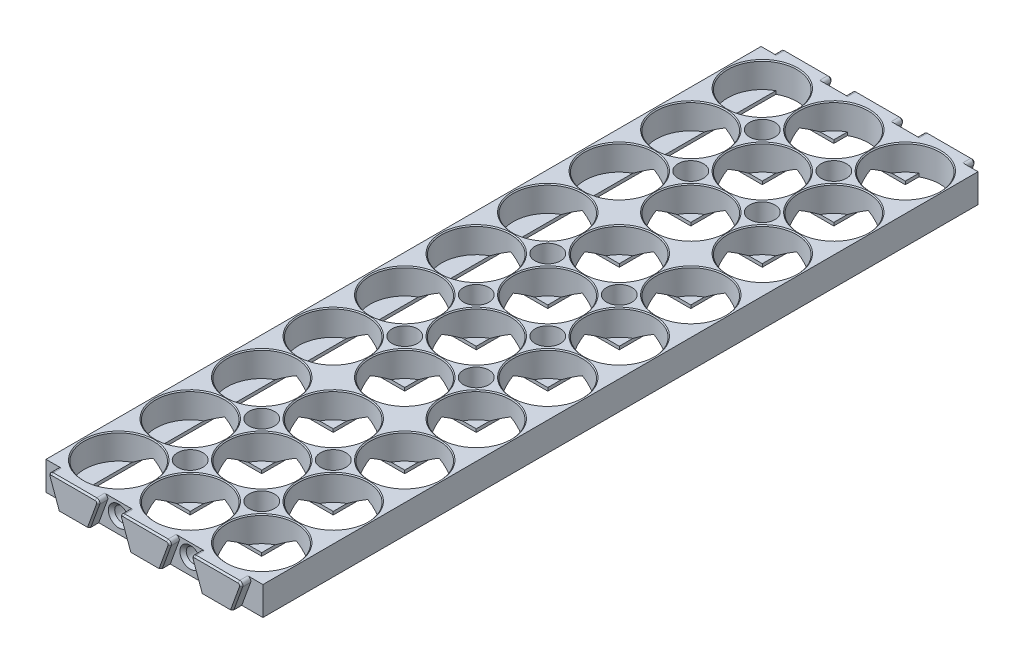
from build123d import *

# Parameters (mm, degrees)
SKETCH1_W                  = 22.5
SKETCH1_H                  = 22.5
SKETCH1_R                  = 10.875
BOSS_EXTRUDE1_DEPTH        = 8
SKETCH2_W                  = 6
SKETCH2_H                  = 6
BOSS_EXTRUDE2_DEPTH        = 1
CHAMFER2_SIZE              = 0.3
LPATTERN1_COUNT            = 10
LPATTERN1_PITCH            = 22.5
LPATTERN1_COUNT_DIR2       = 3
LPATTERN1_PITCH_DIR2       = 22.5
CHAMFER2_OF_LPATTERN1_SIZE = 0.3
SKETCH5_W                  = 6
SKETCH5_H                  = 1
BOSS_EXTRUDE3_DEPTH        = 213
BOSS_EXTRUDE4_START        = 1
BOSS_EXTRUDE4_DEPTH        = 1
CUT_EXTRUDE1_REACH         = 223.172
CUT_EXTRUDE7_REACH         = 223.172
BOSS_EXTRUDE5_DEPTH        = 3
BOSS_EXTRUDE6_DEPTH        = 3
FILLET1_R                  = 1
CHAMFER3_SIZE              = 0.5
SKETCH10_R                 = 2.25
CUT_EXTRUDE2_DEPTH         = 5
CUT_EXTRUDE3_START         = -5
SKETCH11_R                 = 2.25
CUT_EXTRUDE3_DEPTH         = 5
CHAMFER5_SIZE              = 1
SKETCH17_R                 = 4
CUT_EXTRUDE8_DEPTH         = 225.110742714
SKETCH18_R                 = 2.1
CUT_EXTRUDE9_DEPTH         = 4
SKETCH19_R                 = 1.7
CUT_EXTRUDE10_DEPTH        = 7
CHAMFER6_SIZE              = 1
SKETCH22_W                 = 0.375
SKETCH22_H                 = 225
BOSS_EXTRUDE7_DEPTH        = 9
CUT_EXTRUDE11_DEPTH        = 2
CHAMFER7_SIZE              = 0.5


with BuildPart() as part:
    # Sketch1 → Boss-Extrude1 (new body)
    with BuildSketch(Plane(origin=(0, 0, 0), x_dir=(1, 0, 0), z_dir=(0, 1, 0))):
        Rectangle(SKETCH1_W, SKETCH1_H)
        with Locations(Location((0, 0, 0), (0, 0, 270))):
            Circle(SKETCH1_R, mode=Mode.SUBTRACT)
    boss_extrude1 = extrude(amount=BOSS_EXTRUDE1_DEPTH)

    # Sketch2 → Boss-Extrude2 (add)
    with BuildSketch(Plane.XZ):
        with Locations((8.25, 8.25)):
            Rectangle(SKETCH2_W, SKETCH2_H)
        with Locations((8.25, -8.25)):
            Rectangle(SKETCH2_W, SKETCH2_H)
        with Locations((-8.25, -8.25)):
            Rectangle(SKETCH2_W, SKETCH2_H)
        with Locations((-8.25, 8.25)):
            Rectangle(SKETCH2_W, SKETCH2_H)
    boss_extrude2 = extrude(amount=BOSS_EXTRUDE2_DEPTH)

    # Chamfer2
    chamfer2_edges = [part.edges().sort_by_distance(p)[0] for p in [
        (0, 8, -10.875),
    ]]
    chamfer(chamfer2_edges, length=CHAMFER2_SIZE)

    # LPattern1: Boss-Extrude1, Boss-Extrude2 10 × 3
    with Locations(*[(j * LPATTERN1_PITCH_DIR2, 0, i * LPATTERN1_PITCH) for i in range(LPATTERN1_COUNT) for j in range(LPATTERN1_COUNT_DIR2) if (i, j) != (0, 0)]):
        add(boss_extrude1)
        add(boss_extrude2)

    # Chamfer2 of LPattern1
    chamfer2_of_lpattern1_edges = [part.edges().sort_by_distance(p)[0] for p in [
        (22.5, 8, -10.875),
        (45, 8, -10.875),
        (0, 8, 11.625),
        (22.5, 8, 11.625),
        (45, 8, 11.625),
        (0, 8, 34.125),
        (22.5, 8, 34.125),
        (45, 8, 34.125),
        (0, 8, 56.625),
        (22.5, 8, 56.625),
        (45, 8, 56.625),
        (0, 8, 79.125),
        (22.5, 8, 79.125),
        (45, 8, 79.125),
        (0, 8, 101.625),
        (22.5, 8, 101.625),
        (45, 8, 101.625),
        (0, 8, 124.125),
        (22.5, 8, 124.125),
        (45, 8, 124.125),
        (0, 8, 146.625),
        (22.5, 8, 146.625),
        (45, 8, 146.625),
        (0, 8, 169.125),
        (22.5, 8, 169.125),
        (45, 8, 169.125),
        (0, 8, 191.625),
        (22.5, 8, 191.625),
        (45, 8, 191.625),
    ]]
    chamfer(chamfer2_of_lpattern1_edges, length=CHAMFER2_OF_LPATTERN1_SIZE)

    # Sketch5 → Boss-Extrude3 (add)
    with BuildSketch(Plane.XY.offset(-5.25)):
        with Locations((-8.25, -0.5)):
            Rectangle(SKETCH5_W, SKETCH5_H)
        with Locations((53.25, -0.5)):
            Rectangle(SKETCH5_W, SKETCH5_H)
    extrude(amount=BOSS_EXTRUDE3_DEPTH)

    # Sketch6 → Boss-Extrude4 (add)
    with BuildSketch(Plane.XZ.offset(BOSS_EXTRUDE4_START)):
        with BuildLine():
            Line((39.75, -11.25), (50.25, -11.25))
            Line((50.25, -11.25), (50.25, -9.523818824))
            ThreePointArc((50.25, -9.523818824), (45, -10.875), (39.75, -9.523818824))
            Line((39.75, -9.523818824), (39.75, -11.25))
        make_face()
        with BuildLine():
            Line((17.25, -9.523818824), (17.25, -11.25))
            Line((17.25, -11.25), (27.75, -11.25))
            Line((27.75, -11.25), (27.75, -9.523818824))
            ThreePointArc((27.75, -9.523818824), (22.5, -10.875), (17.25, -9.523818824))
        make_face()
        with BuildLine():
            Line((-5.25, -9.523818824), (-5.25, -11.25))
            Line((-5.25, -11.25), (5.25, -11.25))
            Line((5.25, -11.25), (5.25, -9.523818824))
            ThreePointArc((5.25, -9.523818824), (0, -10.875), (-5.25, -9.523818824))
        make_face()
        with BuildLine():
            Line((50.25, 212.023818824), (50.25, 213.75))
            Line((50.25, 213.75), (39.75, 213.75))
            Line((39.75, 213.75), (39.75, 212.023818824))
            ThreePointArc((39.75, 212.023818824), (45, 213.375), (50.25, 212.023818824))
        make_face()
        with BuildLine():
            Line((27.75, 212.023818824), (27.75, 213.75))
            Line((27.75, 213.75), (17.25, 213.75))
            Line((17.25, 213.75), (17.25, 212.023818824))
            ThreePointArc((17.25, 212.023818824), (22.5, 213.375), (27.75, 212.023818824))
        make_face()
        with BuildLine():
            Line((5.25, 213.75), (-5.25, 213.75))
            Line((-5.25, 213.75), (-5.25, 212.023818824))
            ThreePointArc((-5.25, 212.023818824), (0, 213.375), (5.25, 212.023818824))
            Line((5.25, 212.023818824), (5.25, 213.75))
        make_face()
    extrude(amount=-BOSS_EXTRUDE4_DEPTH)

    # Cut-Extrude1: up to this face of the body (flat: up to its plane)
    cut_extrude1_end = Plane(part.part.faces().sort_by_distance((11.25, -0.5, 207.75))[0])
    # Sketch7 → Cut-Extrude1 (cut, up to the picked face)
    with BuildSketch(Plane.XY, mode=Mode.PRIVATE) as cut_extrude1_sk1:
        Polygon((-5.25, 0), (5.25, 0), (0, 3.031088913), align=None)
    cut_extrude1_tool1 = split(extrude(cut_extrude1_sk1.sketch, amount=CUT_EXTRUDE1_REACH, mode=Mode.PRIVATE), bisect_by=cut_extrude1_end, keep=Keep.BOTH, mode=Mode.PRIVATE)
    # Sketch7 → Cut-Extrude1 (cut, up to the picked face)
    with BuildSketch(Plane.XY, mode=Mode.PRIVATE) as cut_extrude1_sk2:
        Polygon((17.25, 0), (22.5, 3.031088913), (27.75, 0), align=None)
    cut_extrude1_tool2 = split(extrude(cut_extrude1_sk2.sketch, amount=CUT_EXTRUDE1_REACH, mode=Mode.PRIVATE), bisect_by=cut_extrude1_end, keep=Keep.BOTH, mode=Mode.PRIVATE)
    # Sketch7 → Cut-Extrude1 (cut, up to the picked face)
    with BuildSketch(Plane.XY, mode=Mode.PRIVATE) as cut_extrude1_sk3:
        Polygon((39.75, 0), (45, 3.031088913), (50.25, 0), align=None)
    cut_extrude1_tool3 = split(extrude(cut_extrude1_sk3.sketch, amount=CUT_EXTRUDE1_REACH, mode=Mode.PRIVATE), bisect_by=cut_extrude1_end, keep=Keep.BOTH, mode=Mode.PRIVATE)
    # Sketch7 → Cut-Extrude1 (cut, up to the picked face)
    with BuildSketch(Plane.XY, mode=Mode.PRIVATE) as cut_extrude1_sk4:
        Polygon((62.25, 0), (67.5, 3.031088913), (72.75, 0), align=None)
    cut_extrude1_tool4 = split(extrude(cut_extrude1_sk4.sketch, amount=CUT_EXTRUDE1_REACH, mode=Mode.PRIVATE), bisect_by=cut_extrude1_end, keep=Keep.BOTH, mode=Mode.PRIVATE)
    add(cut_extrude1_tool1.solids().sort_by(Axis((0, 1.010363, 0), (0, 0, 1)))[0], mode=Mode.SUBTRACT)
    add(cut_extrude1_tool2.solids().sort_by(Axis((22.5, 1.010363, 0), (0, 0, 1)))[0], mode=Mode.SUBTRACT)
    add(cut_extrude1_tool3.solids().sort_by(Axis((45, 1.010363, 0), (0, 0, 1)))[0], mode=Mode.SUBTRACT)
    add(cut_extrude1_tool4.solids().sort_by(Axis((67.5, 1.010363, 0), (0, 0, 1)))[0], mode=Mode.SUBTRACT)

    # Cut-Extrude7: up to this face of the body (flat: up to its plane)
    cut_extrude7_end = Plane(part.part.faces().sort_by_distance((39.75, -0.5, -7.386909412))[0])
    # Sketch16 → Cut-Extrude7 (cut, up to the picked face)
    with BuildSketch(Plane(origin=(0, 0, 0), x_dir=(0, 0, -1), z_dir=(1, 0, 0)), mode=Mode.PRIVATE) as cut_extrude7_sk1:
        Polygon((-5.25, 0), (0, 3.031088913), (5.25, 0), align=None)
    cut_extrude7_tool1 = split(extrude(cut_extrude7_sk1.sketch, amount=CUT_EXTRUDE7_REACH, mode=Mode.PRIVATE), bisect_by=cut_extrude7_end, keep=Keep.BOTH, mode=Mode.PRIVATE)
    # Sketch16 → Cut-Extrude7 (cut, up to the picked face)
    with BuildSketch(Plane(origin=(0, 0, 0), x_dir=(0, 0, -1), z_dir=(1, 0, 0)), mode=Mode.PRIVATE) as cut_extrude7_sk2:
        Polygon((-22.5, 3.031088913), (-17.25, 0), (-27.75, 0), align=None)
    cut_extrude7_tool2 = split(extrude(cut_extrude7_sk2.sketch, amount=CUT_EXTRUDE7_REACH, mode=Mode.PRIVATE), bisect_by=cut_extrude7_end, keep=Keep.BOTH, mode=Mode.PRIVATE)
    # Sketch16 → Cut-Extrude7 (cut, up to the picked face)
    with BuildSketch(Plane(origin=(0, 0, 0), x_dir=(0, 0, -1), z_dir=(1, 0, 0)), mode=Mode.PRIVATE) as cut_extrude7_sk3:
        Polygon((-45, 3.031088913), (-39.75, 0), (-50.25, 0), align=None)
    cut_extrude7_tool3 = split(extrude(cut_extrude7_sk3.sketch, amount=CUT_EXTRUDE7_REACH, mode=Mode.PRIVATE), bisect_by=cut_extrude7_end, keep=Keep.BOTH, mode=Mode.PRIVATE)
    # Sketch16 → Cut-Extrude7 (cut, up to the picked face)
    with BuildSketch(Plane(origin=(0, 0, 0), x_dir=(0, 0, -1), z_dir=(1, 0, 0)), mode=Mode.PRIVATE) as cut_extrude7_sk4:
        Polygon((-67.5, 3.031088913), (-62.25, 0), (-72.75, 0), align=None)
    cut_extrude7_tool4 = split(extrude(cut_extrude7_sk4.sketch, amount=CUT_EXTRUDE7_REACH, mode=Mode.PRIVATE), bisect_by=cut_extrude7_end, keep=Keep.BOTH, mode=Mode.PRIVATE)
    # Sketch16 → Cut-Extrude7 (cut, up to the picked face)
    with BuildSketch(Plane(origin=(0, 0, 0), x_dir=(0, 0, -1), z_dir=(1, 0, 0)), mode=Mode.PRIVATE) as cut_extrude7_sk5:
        Polygon((-90, 3.031088913), (-84.75, 0), (-95.25, 0), align=None)
    cut_extrude7_tool5 = split(extrude(cut_extrude7_sk5.sketch, amount=CUT_EXTRUDE7_REACH, mode=Mode.PRIVATE), bisect_by=cut_extrude7_end, keep=Keep.BOTH, mode=Mode.PRIVATE)
    # Sketch16 → Cut-Extrude7 (cut, up to the picked face)
    with BuildSketch(Plane(origin=(0, 0, 0), x_dir=(0, 0, -1), z_dir=(1, 0, 0)), mode=Mode.PRIVATE) as cut_extrude7_sk6:
        Polygon((-112.5, 3.031088913), (-107.25, 0), (-117.75, 0), align=None)
    cut_extrude7_tool6 = split(extrude(cut_extrude7_sk6.sketch, amount=CUT_EXTRUDE7_REACH, mode=Mode.PRIVATE), bisect_by=cut_extrude7_end, keep=Keep.BOTH, mode=Mode.PRIVATE)
    # Sketch16 → Cut-Extrude7 (cut, up to the picked face)
    with BuildSketch(Plane(origin=(0, 0, 0), x_dir=(0, 0, -1), z_dir=(1, 0, 0)), mode=Mode.PRIVATE) as cut_extrude7_sk7:
        Polygon((-135, 3.031088913), (-129.75, 0), (-140.25, 0), align=None)
    cut_extrude7_tool7 = split(extrude(cut_extrude7_sk7.sketch, amount=CUT_EXTRUDE7_REACH, mode=Mode.PRIVATE), bisect_by=cut_extrude7_end, keep=Keep.BOTH, mode=Mode.PRIVATE)
    # Sketch16 → Cut-Extrude7 (cut, up to the picked face)
    with BuildSketch(Plane(origin=(0, 0, 0), x_dir=(0, 0, -1), z_dir=(1, 0, 0)), mode=Mode.PRIVATE) as cut_extrude7_sk8:
        Polygon((-157.5, 3.031088913), (-152.25, 0), (-162.75, 0), align=None)
    cut_extrude7_tool8 = split(extrude(cut_extrude7_sk8.sketch, amount=CUT_EXTRUDE7_REACH, mode=Mode.PRIVATE), bisect_by=cut_extrude7_end, keep=Keep.BOTH, mode=Mode.PRIVATE)
    # Sketch16 → Cut-Extrude7 (cut, up to the picked face)
    with BuildSketch(Plane(origin=(0, 0, 0), x_dir=(0, 0, -1), z_dir=(1, 0, 0)), mode=Mode.PRIVATE) as cut_extrude7_sk9:
        Polygon((-180, 3.031088913), (-174.75, 0), (-185.25, 0), align=None)
    cut_extrude7_tool9 = split(extrude(cut_extrude7_sk9.sketch, amount=CUT_EXTRUDE7_REACH, mode=Mode.PRIVATE), bisect_by=cut_extrude7_end, keep=Keep.BOTH, mode=Mode.PRIVATE)
    # Sketch16 → Cut-Extrude7 (cut, up to the picked face)
    with BuildSketch(Plane(origin=(0, 0, 0), x_dir=(0, 0, -1), z_dir=(1, 0, 0)), mode=Mode.PRIVATE) as cut_extrude7_sk10:
        Polygon((-202.5, 3.031088913), (-197.25, 0), (-207.75, 0), align=None)
    cut_extrude7_tool10 = split(extrude(cut_extrude7_sk10.sketch, amount=CUT_EXTRUDE7_REACH, mode=Mode.PRIVATE), bisect_by=cut_extrude7_end, keep=Keep.BOTH, mode=Mode.PRIVATE)
    add(cut_extrude7_tool1.solids().sort_by(Axis((0, 1.010363, 0), (1, 0, 0)))[0], mode=Mode.SUBTRACT)
    add(cut_extrude7_tool2.solids().sort_by(Axis((0, 1.010363, 22.5), (1, 0, 0)))[0], mode=Mode.SUBTRACT)
    add(cut_extrude7_tool3.solids().sort_by(Axis((0, 1.010363, 45), (1, 0, 0)))[0], mode=Mode.SUBTRACT)
    add(cut_extrude7_tool4.solids().sort_by(Axis((0, 1.010363, 67.5), (1, 0, 0)))[0], mode=Mode.SUBTRACT)
    add(cut_extrude7_tool5.solids().sort_by(Axis((0, 1.010363, 90), (1, 0, 0)))[0], mode=Mode.SUBTRACT)
    add(cut_extrude7_tool6.solids().sort_by(Axis((0, 1.010363, 112.5), (1, 0, 0)))[0], mode=Mode.SUBTRACT)
    add(cut_extrude7_tool7.solids().sort_by(Axis((0, 1.010363, 135), (1, 0, 0)))[0], mode=Mode.SUBTRACT)
    add(cut_extrude7_tool8.solids().sort_by(Axis((0, 1.010363, 157.5), (1, 0, 0)))[0], mode=Mode.SUBTRACT)
    add(cut_extrude7_tool9.solids().sort_by(Axis((0, 1.010363, 180), (1, 0, 0)))[0], mode=Mode.SUBTRACT)
    add(cut_extrude7_tool10.solids().sort_by(Axis((0, 1.010363, 202.5), (1, 0, 0)))[0], mode=Mode.SUBTRACT)

    # Sketch8 → Boss-Extrude5 (add)
    with BuildSketch(Plane(origin=(0, 0, -11.25), x_dir=(-1, 0, 0), z_dir=(0, 0, -1))):
        Polygon((-27.474267892, -1), (-30.75, 8), (-14.25, 8), (-17.525732108, -1), align=None)
        Polygon((4.974267892, -1), (-4.974267892, -1), (-8.25, 8), (8.25, 8), align=None)
        Polygon((-49.974267892, -1), (-53.25, 8), (-36.75, 8), (-40.025732108, -1), align=None)
    extrude(amount=BOSS_EXTRUDE5_DEPTH)

    # Sketch9 → Boss-Extrude6 (add)
    with BuildSketch(Plane.XY.offset(213.75)):
        Polygon((-4.974267892, -1), (4.974267892, -1), (8.25, 8), (-8.25, 8), align=None)
        Polygon((49.974267892, -1), (53.25, 8), (36.75, 8), (40.025732108, -1), align=None)
        Polygon((14.25, 8), (17.525732108, -1), (27.474267892, -1), (30.75, 8), align=None)
    extrude(amount=BOSS_EXTRUDE6_DEPTH)

    # Fillet1
    fillet1_edges = [part.edges().sort_by_distance(p)[0] for p in [
        (-8.25, 8, -12.75),
        (8.25, 8, -12.75),
        (14.25, 8, -12.75),
        (30.75, 8, -12.75),
        (36.75, 8, -12.75),
        (53.25, 8, -12.75),
        (-8.25, 8, 215.25),
        (8.25, 8, 215.25),
        (53.25, 8, 215.25),
        (36.75, 8, 215.25),
        (30.75, 8, 215.25),
        (14.25, 8, 215.25),
    ]]
    fillet(fillet1_edges, radius=FILLET1_R)

    # Chamfer3
    chamfer3_edges = [part.edges().sort_by_distance(p)[0] for p in [
        (-6.367906253, 2.828989928, -14.25),
        (16.132093747, 2.828989928, -14.25),
        (38.632093747, 2.828989928, -14.25),
        (6.367906253, 2.828989928, 216.75),
        (51.367906253, 2.828989928, 216.75),
        (28.867906253, 2.828989928, 216.75),
        (51.367906253, 2.828989928, -14.25),
        (45, 8, -14.25),
        (22.5, 8, -14.25),
        (0, 8, -14.25),
        (0, 8, 216.75),
        (22.5, 8, 216.75),
        (45, 8, 216.75),
        (37.358995962, 7.573576436, -14.25),
        (52.641004038, 7.573576436, -14.25),
        (28.867906253, 2.828989928, -14.25),
        (14.858995962, 7.573576436, -14.25),
        (30.141004038, 7.573576436, -14.25),
        (6.367906253, 2.828989928, -14.25),
        (-7.641004038, 7.573576436, -14.25),
        (7.641004038, 7.573576436, -14.25),
        (-6.367906253, 2.828989928, 216.75),
        (7.641004038, 7.573576436, 216.75),
        (-7.641004038, 7.573576436, 216.75),
        (16.132093747, 2.828989928, 216.75),
        (30.141004038, 7.573576436, 216.75),
        (14.858995962, 7.573576436, 216.75),
        (38.632093747, 2.828989928, 216.75),
        (52.641004038, 7.573576436, 216.75),
        (37.358995962, 7.573576436, 216.75),
    ]]
    chamfer(chamfer3_edges, length=CHAMFER3_SIZE)

    # Sketch10 → Cut-Extrude2 (cut)
    with BuildSketch(Plane(origin=(0, 0, -11.25), x_dir=(-1, 0, 0), z_dir=(0, 0, -1))):
        with Locations((-11.25, 4)):
            Circle(SKETCH10_R)
        with Locations(Location((-33.75, 4, 0), (0, 0, 180))):
            Circle(SKETCH10_R)
    extrude(amount=-CUT_EXTRUDE2_DEPTH, mode=Mode.SUBTRACT)

    # Sketch11 → Cut-Extrude3 (cut)
    with BuildSketch(Plane.XY.offset(213.75).offset(CUT_EXTRUDE3_START)):
        with Locations(Location((11.25, 4, 0), (0, 0, 180))):
            Circle(SKETCH11_R)
        with Locations((33.75, 4)):
            Circle(SKETCH11_R)
    extrude(amount=CUT_EXTRUDE3_DEPTH, mode=Mode.SUBTRACT)

    # Chamfer5
    chamfer5_edges = [part.edges().sort_by_distance(p)[0] for p in [
        (31.5, 4, -11.25),
        (13.5, 4, -11.25),
        (13.5, 4, 213.75),
        (31.5, 4, 213.75),
    ]]
    chamfer(chamfer5_edges, length=CHAMFER5_SIZE)

    # Sketch17 → Cut-Extrude8 (cut, through all)
    with BuildSketch(Plane.XZ.offset(1)):
        with Locations(Location((11.25, 11.25, 0), (0, 0, 270))):
            Circle(SKETCH17_R)
        with Locations(Location((33.75, 11.25, 0), (0, 0, 270))):
            Circle(SKETCH17_R)
        with Locations(Location((11.25, 33.75, 0), (0, 0, 270))):
            Circle(SKETCH17_R)
        with Locations(Location((33.75, 33.75, 0), (0, 0, 270))):
            Circle(SKETCH17_R)
        with Locations(Location((11.25, 78.75, 0), (0, 0, 270))):
            Circle(SKETCH17_R)
        with Locations(Location((33.75, 78.75, 0), (0, 0, 270))):
            Circle(SKETCH17_R)
        with Locations(Location((11.25, 101.25, 0), (0, 0, 270))):
            Circle(SKETCH17_R)
        with Locations(Location((33.75, 101.25, 0), (0, 0, 270))):
            Circle(SKETCH17_R)
        with Locations(Location((11.25, 123.75, 0), (0, 0, 270))):
            Circle(SKETCH17_R)
        with Locations(Location((33.75, 123.75, 0), (0, 0, 270))):
            Circle(SKETCH17_R)
        with Locations(Location((11.25, 168.75, 0), (0, 0, 270))):
            Circle(SKETCH17_R)
        with Locations(Location((33.75, 168.75, 0), (0, 0, 270))):
            Circle(SKETCH17_R)
        with Locations(Location((11.25, 191.25, 0), (0, 0, 270))):
            Circle(SKETCH17_R)
        with Locations(Location((33.75, 191.25, 0), (0, 0, 270))):
            Circle(SKETCH17_R)
    extrude(amount=-CUT_EXTRUDE8_DEPTH, mode=Mode.SUBTRACT)

    # Sketch18 → Cut-Extrude9 (cut)
    with BuildSketch(Plane.XZ.offset(1)):
        with Locations(Location((11.25, 56.25, 0), (0, 0, 270))):
            Circle(SKETCH18_R)
        with Locations(Location((33.75, 56.25, 0), (0, 0, 270))):
            Circle(SKETCH18_R)
        with Locations(Location((33.75, 146.25, 0), (0, 0, 270))):
            Circle(SKETCH18_R)
        with Locations(Location((11.25, 146.25, 0), (0, 0, 270))):
            Circle(SKETCH18_R)
    extrude(amount=-CUT_EXTRUDE9_DEPTH, mode=Mode.SUBTRACT)

    # Sketch19 → Cut-Extrude10 (cut)
    with BuildSketch(Plane.XZ.offset(1)):
        with Locations(Location((33.75, 146.25, 0), (0, 0, 270))):
            Circle(SKETCH19_R)
        with Locations(Location((11.25, 56.25, 0), (0, 0, 270))):
            Circle(SKETCH19_R)
        with Locations(Location((11.25, 146.25, 0), (0, 0, 270))):
            Circle(SKETCH19_R)
        with Locations(Location((33.75, 56.25, 0), (0, 0, 270))):
            Circle(SKETCH19_R)
    extrude(amount=-CUT_EXTRUDE10_DEPTH, mode=Mode.SUBTRACT)

    # Chamfer6
    chamfer6_edges = [part.edges().sort_by_distance(p)[0] for p in [
        (11.25, -1, 148.35),
        (33.75, -1, 148.35),
        (33.75, -1, 58.35),
        (11.25, -1, 58.35),
    ]]
    chamfer(chamfer6_edges, length=CHAMFER6_SIZE)

    # Sketch22 → Boss-Extrude7 (add)
    with BuildSketch(Plane(origin=(0, 8, 0), x_dir=(1, 0, 0), z_dir=(0, 1, 0))):
        with Locations((-11.4375, -101.25)):
            Rectangle(SKETCH22_W, SKETCH22_H)
        with Locations((56.4375, -101.25)):
            Rectangle(SKETCH22_W, SKETCH22_H)
    extrude(amount=-BOSS_EXTRUDE7_DEPTH)

    # Sketch14 → Cut-Extrude11 (cut)
    with BuildSketch(Plane.XZ.offset(1)):
        Polygon((-6.25, 10.25), (-6.25, 12.25), (-10.25, 13.705880937), (-10.25, 8.794119063), align=None)
        Polygon((-6.25, 100.25), (-6.25, 102.25), (-10.25, 103.705880937), (-10.25, 98.794119063), align=None)
        Polygon((-10.25, 193.705880937), (-6.25, 192.25), (-6.25, 190.25), (-10.25, 188.794119063), align=None)
        Polygon((55.25, 98.794119063), (51.25, 100.25), (51.25, 102.25), (55.25, 103.705880937), align=None)
        Polygon((51.25, 192.25), (51.25, 190.25), (55.25, 188.794119063), (55.25, 193.705880937), align=None)
        Polygon((55.25, 8.794119063), (51.25, 10.25), (51.25, 12.25), (55.25, 13.705880937), align=None)
    extrude(amount=-CUT_EXTRUDE11_DEPTH, mode=Mode.SUBTRACT)

    # Chamfer7
    chamfer7_edges = [part.edges().sort_by_distance(p)[0] for p in [
        (55.25, -1, 11.25),
        (53.25, -1, 12.977940469),
        (51.25, -1, 11.25),
        (53.25, -1, 9.522059531),
        (53.25, -1, 192.977940469),
        (51.25, -1, 191.25),
        (53.25, -1, 189.522059531),
        (55.25, -1, 191.25),
        (55.25, -1, 101.25),
        (53.25, -1, 102.977940469),
        (51.25, -1, 101.25),
        (53.25, -1, 99.522059531),
        (-10.25, -1, 191.25),
        (-8.25, -1, 189.522059531),
        (-6.25, -1, 191.25),
        (-8.25, -1, 192.977940469),
        (-8.25, -1, 102.977940469),
        (-10.25, -1, 101.25),
        (-8.25, -1, 99.522059531),
        (-6.25, -1, 101.25),
        (-8.25, -1, 12.977940469),
        (-10.25, -1, 11.25),
        (-8.25, -1, 9.522059531),
        (-6.25, -1, 11.25),
    ]]
    chamfer(chamfer7_edges, length=CHAMFER7_SIZE)


solid = part.part
